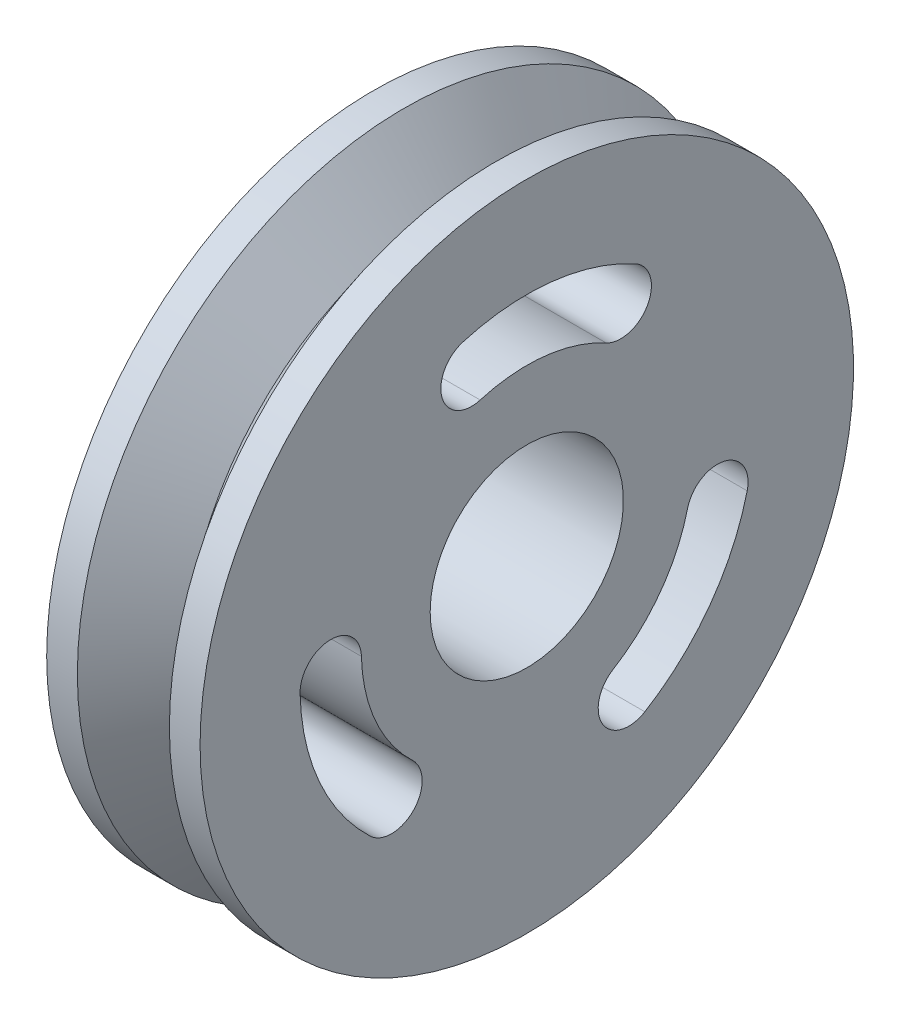
from build123d import *

# Parameters (mm, degrees)
CUT_EXTRUDE1_DEPTH      = 21.153752752
CUT_EXTRUDE1_DEPTH_BACK = 21.153752752


with BuildPart() as part:
    # Sketch1 → Revolve1 (revolve)
    with BuildSketch(Plane.XY):
        Polygon((1.27, 13.525), (3.175, 10.985), (5.08, 13.525), (6.35, 13.525), (6.35, 4), (0, 4), (0, 13.525), align=None)
    revolve(axis=Axis((0, 0, 0), (1, 0, 0)))

    # Sketch2 → Cut-Extrude1 (cut, two sides: drawn at the far end of the back side and taken through both)
    with BuildSketch(Plane.ZY.offset(-CUT_EXTRUDE1_DEPTH_BACK)):
        with BuildLine():
            ThreePointArc((1.930005774, 6.569877833), (3.506472615, 7.430431317), (2.645919131, 9.006898158))
            ThreePointArc((2.645919131, 9.006898158), (-1.002280172, 9.333838275), (-4.497891405, 8.239786125))
            ThreePointArc((-4.497891405, 8.239786125), (-5.004118595, 6.516552527), (-3.280884997, 6.010325338))
            ThreePointArc((-3.280884997, 6.010325338), (-0.731090567, 6.808356895), (1.930005774, 6.569877833))
        make_face()
        with BuildLine():
            ThreePointArc((4.724678216, -4.956372946), (4.681705974, -6.751910021), (6.477243049, -6.794882263))
            ThreePointArc((6.477243049, -6.794882263), (8.584481147, -3.798919046), (9.384809809, -0.224604842))
            ThreePointArc((9.384809809, -0.224604842), (8.145559331, 1.075417563), (6.845536926, -0.163832914))
            ThreePointArc((6.845536926, -0.163832914), (6.261755313, -2.771035444), (4.724678216, -4.956372946))
        make_face()
        with BuildLine():
            ThreePointArc((-6.65468399, -1.613504887), (-8.188178589, -0.678521296), (-9.12316218, -2.212015895))
            ThreePointArc((-9.12316218, -2.212015895), (-7.582200975, -5.534919228), (-4.886918404, -8.015181283))
            ThreePointArc((-4.886918404, -8.015181283), (-3.141440736, -7.59197009), (-3.564651929, -5.846492423))
            ThreePointArc((-3.564651929, -5.846492423), (-5.530664745, -4.037321451), (-6.65468399, -1.613504887))
        make_face()
    extrude(amount=CUT_EXTRUDE1_DEPTH + CUT_EXTRUDE1_DEPTH_BACK, mode=Mode.SUBTRACT)


solid = part.part
